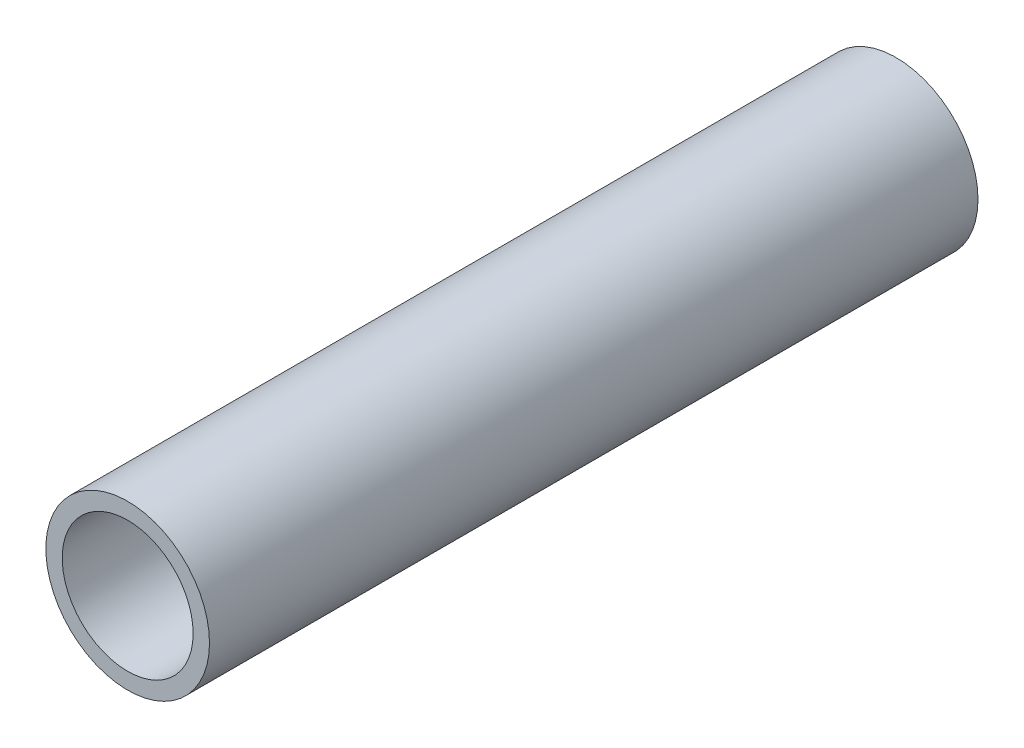
from build123d import *

# Parameters (mm, degrees)
SKETCH1_R           = 1.25
SKETCH1_R_2         = 1
BOSS_EXTRUDE1_DEPTH = 11.74


with BuildPart() as part:
    # Sketch1 → Boss-Extrude1 (new body)
    with BuildSketch(Plane.XY):
        Circle(SKETCH1_R)
        Circle(SKETCH1_R_2, mode=Mode.SUBTRACT)
    extrude(amount=BOSS_EXTRUDE1_DEPTH)


solid = part.part
